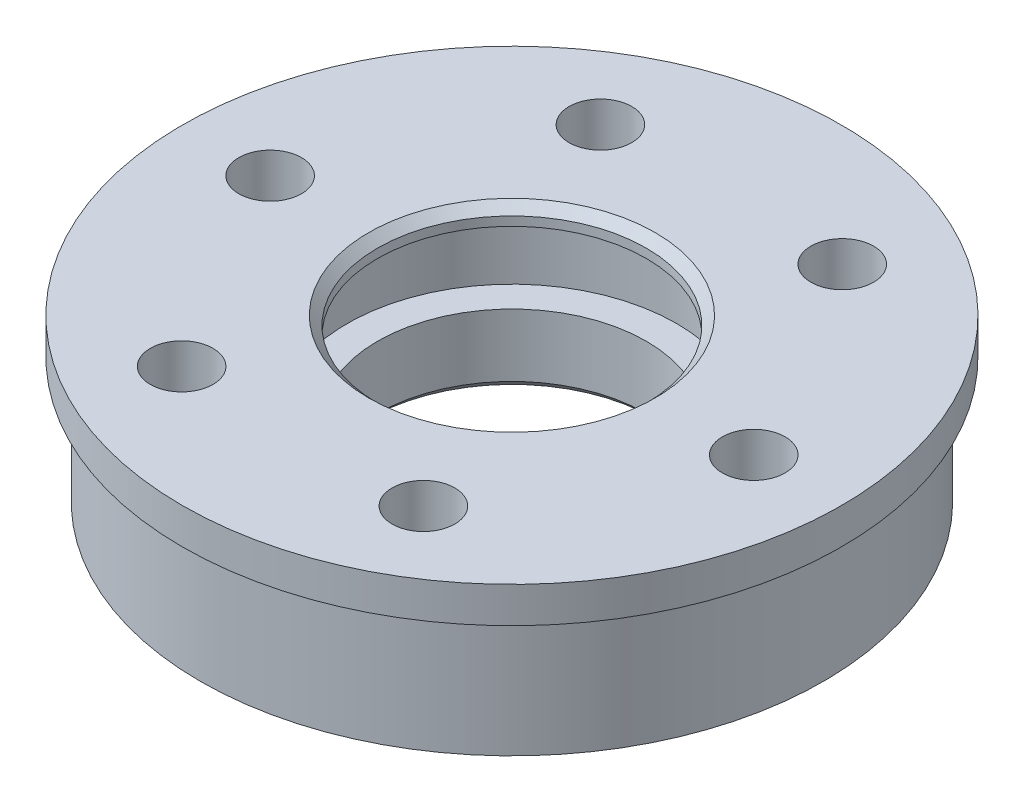
from build123d import *

# Parameters (mm, degrees)
SKETCH1_R           = 17.4
SKETCH1_R_2         = 1.75
SKETCH1_R_3         = 7.5
BOSS_EXTRUDE1_DEPTH = 4.5
CUT_EXTRUDE1_START  = -0.5
SKETCH2_R           = 9.2
CUT_EXTRUDE1_DEPTH  = 4
SKETCH3_R           = 15.25
SKETCH3_R_2         = 11.75
BOSS_EXTRUDE2_DEPTH = 1.5
CHAMFER1_SIZE       = 0.5
SKETCH4_R           = 18.4
SKETCH4_R_2         = 17.4
BOSS_EXTRUDE3_DEPTH = 2
SKETCH5_R           = 2.35
CUT_EXTRUDE2_DEPTH  = 4


with BuildPart() as part:
    # Sketch1 → Boss-Extrude1 (new, symmetric)
    with BuildSketch(Plane(origin=(0, 0, 0), x_dir=(1, 0, 0), z_dir=(0, 1, 0))):
        Circle(SKETCH1_R)
        with Locations((13.5, 0)):
            Circle(SKETCH1_R_2, mode=Mode.SUBTRACT)
        with Locations((6.75, -11.691342951)):
            Circle(SKETCH1_R_2, mode=Mode.SUBTRACT)
        with Locations((-6.75, -11.691342951)):
            Circle(SKETCH1_R_2, mode=Mode.SUBTRACT)
        with Locations((-13.5, 0)):
            Circle(SKETCH1_R_2, mode=Mode.SUBTRACT)
        with Locations((-6.75, 11.691342951)):
            Circle(SKETCH1_R_2, mode=Mode.SUBTRACT)
        with Locations((6.75, 11.691342951)):
            Circle(SKETCH1_R_2, mode=Mode.SUBTRACT)
        Circle(SKETCH1_R_3, mode=Mode.SUBTRACT)
    extrude(amount=BOSS_EXTRUDE1_DEPTH, both=True)

    # Sketch2 → Cut-Extrude1 (cut)
    with BuildSketch(Plane(origin=(0, 0, 0), x_dir=(1, 0, 0), z_dir=(0, 1, 0)).offset(CUT_EXTRUDE1_START)):
        Circle(SKETCH2_R)
    extrude(amount=CUT_EXTRUDE1_DEPTH, mode=Mode.SUBTRACT)

    # Sketch3 → Boss-Extrude2 (add)
    with BuildSketch(Plane.XZ.offset(4.5)):
        Circle(SKETCH3_R)
        Circle(SKETCH3_R_2, mode=Mode.SUBTRACT)
    extrude(amount=-BOSS_EXTRUDE2_DEPTH)

    # Chamfer1
    chamfer1_edges = [part.edges().sort_by_distance(p)[0] for p in [
        (-7.5, -4.5, 0),
        (-7.5, 4.5, 0),
    ]]
    chamfer(chamfer1_edges, length=CHAMFER1_SIZE)

    # Sketch4 → Boss-Extrude3 (add)
    with BuildSketch(Plane(origin=(0, 4.5, 0), x_dir=(1, 0, 0), z_dir=(0, 1, 0))):
        Circle(SKETCH4_R)
        Circle(SKETCH4_R_2, mode=Mode.SUBTRACT)
    extrude(amount=-BOSS_EXTRUDE3_DEPTH)

    # Sketch5 → Cut-Extrude2 (cut)
    with BuildSketch(Plane(origin=(0, -4.5, 0), x_dir=(-1, 0, 0), z_dir=(0, -1, 0))):
        with Locations((-10.825317547, -6.25)):
            Circle(SKETCH5_R)
        with Locations((-10.825317547, 6.25)):
            Circle(SKETCH5_R)
        with Locations((0, 12.5)):
            Circle(SKETCH5_R)
        with Locations((10.825317547, 6.25)):
            Circle(SKETCH5_R)
        with Locations((10.825317547, -6.25)):
            Circle(SKETCH5_R)
        with Locations((0, -12.5)):
            Circle(SKETCH5_R)
    extrude(amount=-CUT_EXTRUDE2_DEPTH, mode=Mode.SUBTRACT)


solid = part.part
